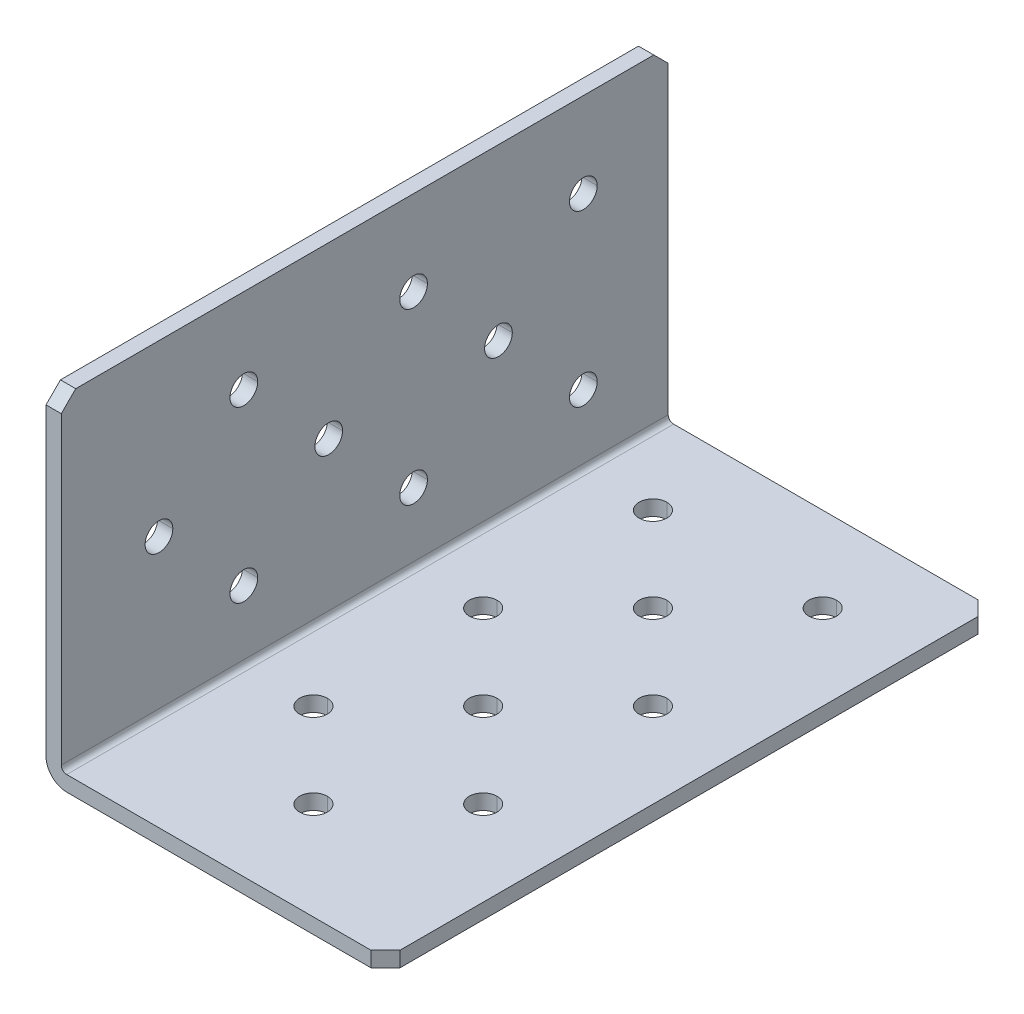
from build123d import *

# Parameters (mm, degrees)
CUT_EXTRUDE1_START       = 14.7701
CUT_EXTRUDE1_OUTLINE_W   = 2.286
CUT_EXTRUDE1_OUTLINE_H   = 127
CUT_EXTRUDE1_DEPTH       = 8.5598
CUT_EXTRUDE1_START_2     = 27.4701
CUT_EXTRUDE1_2_OUTLINE_W = 2.286
CUT_EXTRUDE1_2_OUTLINE_H = 127
CUT_EXTRUDE1_2_DEPTH     = 8.5598
CUT_EXTRUDE1_START_3     = 40.1701
CUT_EXTRUDE1_3_OUTLINE_W = 2.286
CUT_EXTRUDE1_3_OUTLINE_H = 127
CUT_EXTRUDE1_3_DEPTH     = 8.4709
CUT_EXTRUDE1_START_4     = 2.286
CUT_EXTRUDE1_4_OUTLINE_W = 2.286
CUT_EXTRUDE1_4_OUTLINE_H = 127
CUT_EXTRUDE1_4_DEPTH     = 8.3439
CUT_EXTRUDE1_5_OUTLINE_R = 2.0701
CUT_EXTRUDE1_5_DEPTH     = 3.0988
CUT_EXTRUDE1_START_5     = 10.6299
CUT_EXTRUDE1_6_OUTLINE_W = 2.286
CUT_EXTRUDE1_6_OUTLINE_H = 127
CUT_EXTRUDE1_6_DEPTH     = 40.1701
CUT_EXTRUDE1_START_6     = -1
CUT_EXTRUDE1_7_OUTLINE_R = 2.0701
CUT_EXTRUDE1_7_DEPTH     = 3.286
CUT_EXTRUDE1_START_7     = -749.3
CUT_EXTRUDE1_8_DEPTH     = 127
CUT_EXTRUDE1_START_8     = 564.229492087
CUT_EXTRUDE1_9_OUTLINE_W = 3.286
CUT_EXTRUDE1_9_OUTLINE_H = 75
CUT_EXTRUDE1_9_DEPTH     = 2.770507913
CHAMFER1_SIZE            = 2.159
BOSS_EXTRUDE1_START      = -2.286
BOSS_EXTRUDE1_DEPTH      = 2.286
BOSS_EXTRUDE2_START      = -2.286
BOSS_EXTRUDE2_DEPTH      = 2.286
SKETCH4_W                = 50.8
SKETCH4_H                = 50.8
CUT_EXTRUDE2_DEPTH       = 36.181674144
BOSS_EXTRUDE3_DEPTH      = 2.286
BOSS_EXTRUDE4_START      = -2.286
BOSS_EXTRUDE4_DEPTH      = 2.286
CHAMFER2_SIZE            = 2.159


with BuildPart() as part:
    # Cut-Extrude1: read off the stored shape, not the designer's step
    # Cut-Extrude1 outline → Cut-Extrude1 (new body)
    with BuildSketch(Plane(origin=(0, 0, 0), x_dir=(1, 0, 0), z_dir=(0, 1, 0)).offset(CUT_EXTRUDE1_START)):
        with Locations((1.143, 685.8)):
            Rectangle(CUT_EXTRUDE1_OUTLINE_W, CUT_EXTRUDE1_OUTLINE_H)
    extrude(amount=CUT_EXTRUDE1_DEPTH)



with BuildPart() as body_2:
    # Cut-Extrude1 2 outline → Cut-Extrude1 2 (new body)
    with BuildSketch(Plane(origin=(0, 0, 0), x_dir=(1, 0, 0), z_dir=(0, 1, 0)).offset(CUT_EXTRUDE1_START_2)):
        with Locations((1.143, 685.8)):
            Rectangle(CUT_EXTRUDE1_2_OUTLINE_W, CUT_EXTRUDE1_2_OUTLINE_H)
    extrude(amount=CUT_EXTRUDE1_2_DEPTH)


with BuildPart() as body_3:
    # Cut-Extrude1 3 outline → Cut-Extrude1 3 (new body)
    with BuildSketch(Plane(origin=(0, 0, 0), x_dir=(1, 0, 0), z_dir=(0, 1, 0)).offset(CUT_EXTRUDE1_START_3)):
        with Locations((1.143, 685.8)):
            Rectangle(CUT_EXTRUDE1_3_OUTLINE_W, CUT_EXTRUDE1_3_OUTLINE_H)
    extrude(amount=CUT_EXTRUDE1_3_DEPTH)


with BuildPart() as body_4:
    # Cut-Extrude1 4 outline → Cut-Extrude1 4 (new body)
    with BuildSketch(Plane(origin=(0, 0, 0), x_dir=(1, 0, 0), z_dir=(0, 1, 0)).offset(CUT_EXTRUDE1_START_4)):
        with Locations((1.143, 685.8)):
            Rectangle(CUT_EXTRUDE1_4_OUTLINE_W, CUT_EXTRUDE1_4_OUTLINE_H)
    extrude(amount=CUT_EXTRUDE1_4_DEPTH)

    # Cut-Extrude1 5 outline → Cut-Extrude1 5 (add)
    with BuildSketch(Plane(origin=(0, 0, 0), x_dir=(1, 0, 0), z_dir=(0, 1, 0))):
        with BuildLine():
            ThreePointArc((23.3299, 622.3), (23.936218252, 623.763781748), (25.4, 624.3701))
            ThreePointArc((25.4, 624.3701), (26.863781748, 623.763781748), (27.4701, 622.3))
            Line((27.4701, 622.3), (50.8, 622.3))
            Line((50.8, 622.3), (50.8, 747.141))
            Line((50.8, 747.141), (48.641, 749.3))
            Line((48.641, 749.3), (0, 749.3))
            Line((0, 749.3), (0, 622.3))
            Line((0, 622.3), (23.3299, 622.3))
        make_face()
        with Locations((12.7, 635)):
            Circle(CUT_EXTRUDE1_5_OUTLINE_R, mode=Mode.SUBTRACT)
        with Locations((25.4, 647.7)):
            Circle(CUT_EXTRUDE1_5_OUTLINE_R, mode=Mode.SUBTRACT)
        with Locations((12.7, 660.4)):
            Circle(CUT_EXTRUDE1_5_OUTLINE_R, mode=Mode.SUBTRACT)
        with Locations((25.4, 673.1)):
            Circle(CUT_EXTRUDE1_5_OUTLINE_R, mode=Mode.SUBTRACT)
        with Locations((38.1, 635)):
            Circle(CUT_EXTRUDE1_5_OUTLINE_R, mode=Mode.SUBTRACT)
        with Locations((38.1, 660.4)):
            Circle(CUT_EXTRUDE1_5_OUTLINE_R, mode=Mode.SUBTRACT)
        with Locations((12.7, 685.8)):
            Circle(CUT_EXTRUDE1_5_OUTLINE_R, mode=Mode.SUBTRACT)
        with Locations((12.7, 711.2)):
            Circle(CUT_EXTRUDE1_5_OUTLINE_R, mode=Mode.SUBTRACT)
        with Locations((25.4, 698.5)):
            Circle(CUT_EXTRUDE1_5_OUTLINE_R, mode=Mode.SUBTRACT)
        with Locations((12.7, 736.6)):
            Circle(CUT_EXTRUDE1_5_OUTLINE_R, mode=Mode.SUBTRACT)
        with Locations((25.4, 723.9)):
            Circle(CUT_EXTRUDE1_5_OUTLINE_R, mode=Mode.SUBTRACT)
        with Locations((38.1, 685.8)):
            Circle(CUT_EXTRUDE1_5_OUTLINE_R, mode=Mode.SUBTRACT)
        with Locations((38.1, 711.2)):
            Circle(CUT_EXTRUDE1_5_OUTLINE_R, mode=Mode.SUBTRACT)
        with Locations((38.1, 736.6)):
            Circle(CUT_EXTRUDE1_5_OUTLINE_R, mode=Mode.SUBTRACT)
    extrude(amount=CUT_EXTRUDE1_5_DEPTH)


with BuildPart() as part_1:
    add(part.part)

    add(body_2.part)  # Cut-Extrude1 6 merges body 2

    add(body_3.part)  # Cut-Extrude1 6 merges body 3

    add(body_4.part)  # Cut-Extrude1 6 merges body 4
    # Cut-Extrude1 6 outline → Cut-Extrude1 6 (add)
    with BuildSketch(Plane(origin=(0, 0, 0), x_dir=(1, 0, 0), z_dir=(0, 1, 0)).offset(CUT_EXTRUDE1_START_5)):
        with Locations((1.143, 685.8)):
            Rectangle(CUT_EXTRUDE1_6_OUTLINE_W, CUT_EXTRUDE1_6_OUTLINE_H)
    extrude(amount=CUT_EXTRUDE1_6_DEPTH)

    # Cut-Extrude1 7 outline → Cut-Extrude1 7 (cut)
    with BuildSketch(Plane.YZ.offset(CUT_EXTRUDE1_START_6)):
        with BuildLine():
            ThreePointArc((23.3299, -622.3), (23.936218252, -623.763781748), (25.4, -624.3701))
            ThreePointArc((25.4, -624.3701), (26.863781748, -623.763781748), (27.4701, -622.3))
            Line((27.4701, -622.3), (23.3299, -622.3))
        make_face()
        with Locations((25.4, -723.9)):
            Circle(CUT_EXTRUDE1_7_OUTLINE_R)
        with Locations((25.4, -698.5)):
            Circle(CUT_EXTRUDE1_7_OUTLINE_R)
        with Locations((25.4, -673.1)):
            Circle(CUT_EXTRUDE1_7_OUTLINE_R)
        with Locations((25.4, -647.7)):
            Circle(CUT_EXTRUDE1_7_OUTLINE_R)
        with Locations((12.7, -736.6)):
            Circle(CUT_EXTRUDE1_7_OUTLINE_R)
        with Locations((12.7, -711.2)):
            Circle(CUT_EXTRUDE1_7_OUTLINE_R)
        with Locations((12.7, -685.8)):
            Circle(CUT_EXTRUDE1_7_OUTLINE_R)
        with Locations((12.7, -660.4)):
            Circle(CUT_EXTRUDE1_7_OUTLINE_R)
        with Locations((12.7, -635)):
            Circle(CUT_EXTRUDE1_7_OUTLINE_R)
        with Locations((38.1, -736.6)):
            Circle(CUT_EXTRUDE1_7_OUTLINE_R)
        with Locations((38.1, -711.2)):
            Circle(CUT_EXTRUDE1_7_OUTLINE_R)
        with Locations((38.1, -685.8)):
            Circle(CUT_EXTRUDE1_7_OUTLINE_R)
        with Locations((38.1, -660.4)):
            Circle(CUT_EXTRUDE1_7_OUTLINE_R)
        with Locations((38.1, -635)):
            Circle(CUT_EXTRUDE1_7_OUTLINE_R)
    extrude(amount=CUT_EXTRUDE1_7_DEPTH, mode=Mode.SUBTRACT)

    # Cut-Extrude1 8 outline → Cut-Extrude1 8 (cut)
    with BuildSketch(Plane.XY.offset(CUT_EXTRUDE1_START_7)):
        with BuildLine():
            ThreePointArc((3.0988, 0), (0.907617506, 0.907617506), (0, 3.0988))
            Line((0, 3.0988), (2.4e-08, 50))
            Line((2.4e-08, 50), (-1, 50))
            Line((-1, 50), (-1, -1))
            Line((-1, -1), (50.8, -1))
            Line((50.8, -1), (50.8, 0))
            Line((50.8, 0), (3.0988, 0))
        make_face()
        with BuildLine():
            Line((3.0988, 2.286), (50.8, 2.286))
            Line((50.8, 2.286), (50.8, 3.0988))
            Line((50.8, 3.0988), (2.286, 3.0988))
            ThreePointArc((2.286, 3.0988), (2.524063608, 2.524063608), (3.0988, 2.286))
        make_face()
    extrude(amount=CUT_EXTRUDE1_8_DEPTH, mode=Mode.SUBTRACT)

    # Cut-Extrude1 9 outline → Cut-Extrude1 9 (cut)
    with BuildSketch(Plane(origin=(0, 0, 0), x_dir=(1, 0, 0), z_dir=(0, 0.7071067811865511, -0.7071067811865441)).offset(CUT_EXTRUDE1_START_8)):
        with Locations((0.643, 459.5)):
            Rectangle(CUT_EXTRUDE1_9_OUTLINE_W, CUT_EXTRUDE1_9_OUTLINE_H)
    extrude(amount=CUT_EXTRUDE1_9_DEPTH, mode=Mode.SUBTRACT)

    # Chamfer1
    chamfer1_edges = [part_1.edges().sort_by_distance(p)[0] for p in [
        (1.143, 50.8, -622.3),
        (50.8, 1.143, -622.3),
    ]]
    chamfer(chamfer1_edges, length=CHAMFER1_SIZE)

    # Sketch2 → Boss-Extrude1 (add)
    with BuildSketch(Plane(origin=(2.286, 0, 0), x_dir=(0, 0, -1), z_dir=(1, 0, 0)).offset(BOSS_EXTRUDE1_START)):
        with BuildLine():
            Line((622.3, 27.4701), (622.3, 23.3299))
            ThreePointArc((622.3, 23.3299), (624.3701, 25.4), (622.3, 27.4701))
        make_face()
    extrude(amount=BOSS_EXTRUDE1_DEPTH)

    # Sketch3 → Boss-Extrude2 (add)
    with BuildSketch(Plane(origin=(0, 2.286, 0), x_dir=(1, 0, 0), z_dir=(0, 1, 0)).offset(BOSS_EXTRUDE2_START)):
        with BuildLine():
            Line((23.3299, 622.3), (27.4701, 622.3))
            ThreePointArc((27.4701, 622.3), (25.4, 624.3701), (23.3299, 622.3))
        make_face()
    extrude(amount=BOSS_EXTRUDE2_DEPTH)

    # Sketch4 → Cut-Extrude2 (cut)
    with BuildSketch(Plane.XY.offset(-622.3)):
        with Locations((25.4, 25.4)):
            Rectangle(SKETCH4_W, SKETCH4_H)
    extrude(amount=-CUT_EXTRUDE2_DEPTH, mode=Mode.SUBTRACT)

    # Sketch5 → Boss-Extrude3 (add)
    with BuildSketch(Plane.XZ):
        with BuildLine():
            Line((38.878035938, -658.481674144), (37.321964062, -658.481674144))
            ThreePointArc((37.321964062, -658.481674144), (38.1, -662.4701), (38.878035938, -658.481674144))
        make_face()
        with BuildLine():
            Line((13.478035938, -658.481674144), (11.921964062, -658.481674144))
            ThreePointArc((11.921964062, -658.481674144), (12.7, -662.4701), (13.478035938, -658.481674144))
        make_face()
    extrude(amount=-BOSS_EXTRUDE3_DEPTH)

    # Sketch6 → Boss-Extrude4 (add)
    with BuildSketch(Plane(origin=(2.286, 0, 0), x_dir=(0, 0, -1), z_dir=(1, 0, 0)).offset(BOSS_EXTRUDE4_START)):
        with BuildLine():
            Line((658.481674144, 38.878035938), (658.481674144, 37.321964062))
            ThreePointArc((658.481674144, 37.321964062), (662.4701, 38.1), (658.481674144, 38.878035938))
        make_face()
        with BuildLine():
            Line((658.481674144, 11.921964062), (658.481674144, 13.478035938))
            ThreePointArc((658.481674144, 13.478035938), (662.4701, 12.7), (658.481674144, 11.921964062))
        make_face()
    extrude(amount=BOSS_EXTRUDE4_DEPTH)

    # Chamfer2
    chamfer2_edges = [part_1.edges().sort_by_distance(p)[0] for p in [
        (50.8, 1.143, -658.481674144),
        (1.143, 50.8, -658.481674144),
    ]]
    chamfer(chamfer2_edges, length=CHAMFER2_SIZE)


solid = part_1.part
